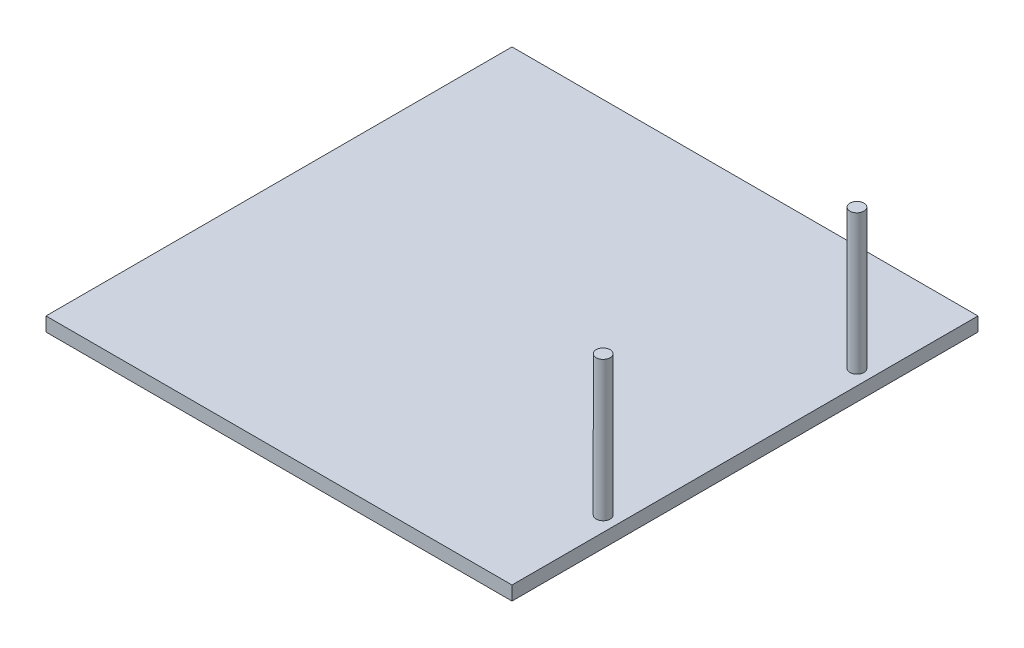
from build123d import *

# Parameters (mm, degrees)
SKETCH1_W           = 100
SKETCH1_H           = 100
BOSS_EXTRUDE1_DEPTH = 3
SKETCH2_R           = 1.5
BOSS_EXTRUDE2_DEPTH = 30


with BuildPart() as part:
    # Sketch1 → Boss-Extrude1 (new body)
    with BuildSketch(Plane(origin=(0, 0, 0), x_dir=(1, 0, 0), z_dir=(0, 1, 0))):
        Rectangle(SKETCH1_W, SKETCH1_H)
    extrude(amount=BOSS_EXTRUDE1_DEPTH)

    # Sketch2 → Boss-Extrude2 (add)
    with BuildSketch(Plane(origin=(0, 3, 0), x_dir=(1, 0, 0), z_dir=(0, 1, 0))):
        with Locations((46.789666573, 27.234893969)):
            Circle(SKETCH2_R)
        with Locations((46.789666573, -27.234893969)):
            Circle(SKETCH2_R)
    extrude(amount=BOSS_EXTRUDE2_DEPTH)


solid = part.part
